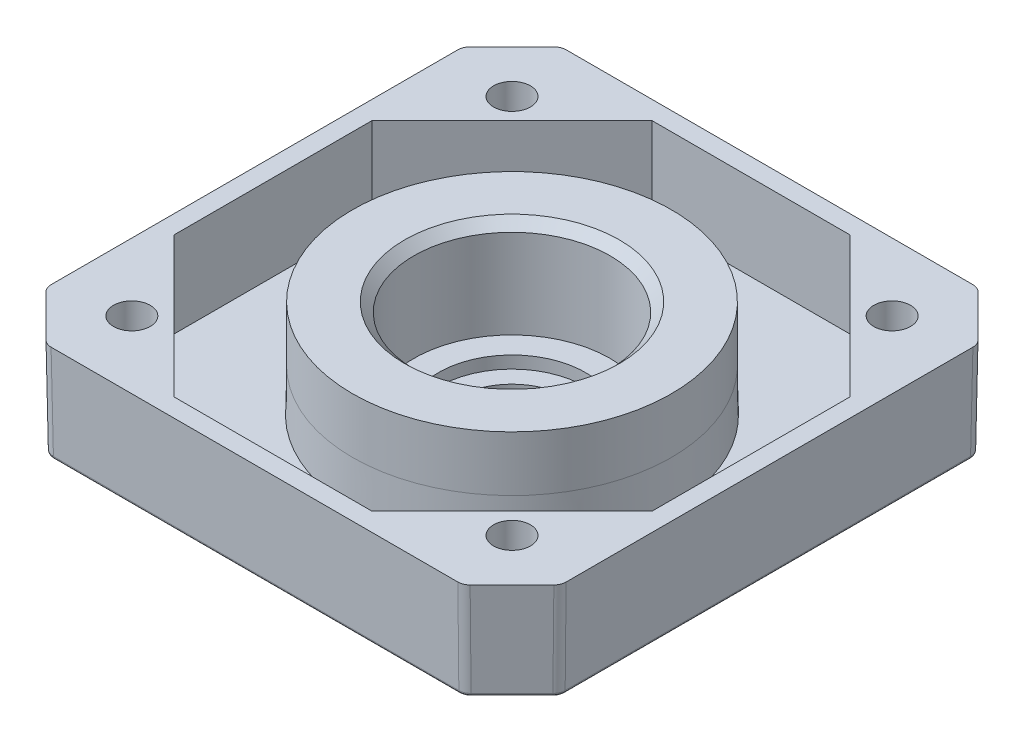
from build123d import *

# Parameters (mm, degrees)
BOSS_EXTRUDE1_DEPTH = 8
BOSS_EXTRUDE1_DRAFT = -1
SKETCH14_R          = 11
BOSS_EXTRUDE8_DEPTH = 2
FILLET2_R           = 1
CUT_EXTRUDE1_DEPTH  = 7
BOSS_EXTRUDE5_REACH = 36.012
BOSS_EXTRUDE5_START = 3.5
SKETCH6_R           = 13
BOSS_EXTRUDE5_DRAFT = 1
SKETCH7_R           = 13
BOSS_EXTRUDE6_DEPTH = 4.5
SKETCH15_R          = 1.5
CUT_EXTRUDE7_DEPTH  = 32.336879232
FILLET3_R           = 0.25
FILLET4_R           = 0.25


with BuildPart() as part:
    # Sketch1 → Boss-Extrude1 (with draft: the straight prism first)
    with BuildSketch(Plane(origin=(0, 0, 0), x_dir=(1, 0, 0), z_dir=(0, 1, 0))):
        Polygon((-17, 21), (-21, 17), (-21, -17), (-17, -21), (17, -21), (21, -17), (21, 17), (17, 21), align=None)
    extrude(amount=-BOSS_EXTRUDE1_DEPTH)
    # Boss-Extrude1: the draft: its side faces are tilted about the plane it starts from
    boss_extrude1_sides = [part.faces().sort_by_distance(p)[0] for p in [
        (-19, -4, -19),
        (-21, -4, 0),
        (-19, -4, 19),
        (0, -4, 21),
        (19, -4, 19),
        (21, -4, 0),
        (19, -4, -19),
        (0, -4, -21),
    ]]
    draft(boss_extrude1_sides, Plane(origin=(0, 0, 0), x_dir=(1, 0, 0), z_dir=(0, 1, 0)), BOSS_EXTRUDE1_DRAFT)

    # Sketch14 → Boss-Extrude8 (add)
    with BuildSketch(Plane.XZ.offset(8)):
        Circle(SKETCH14_R)
    extrude(amount=BOSS_EXTRUDE8_DEPTH)

    # Fillet2
    fillet2_edges = [part.edges().sort_by_distance(p)[0] for p in [
        (-20.93017974, -4, 16.971079501),
        (-16.971079501, -4, 20.93017974),
        (16.971079501, -4, 20.93017974),
        (20.93017974, -4, 16.971079501),
        (-20.93017974, -4, -16.971079501),
        (-16.971079501, -4, -20.93017974),
        (20.93017974, -4, -16.971079501),
        (16.971079501, -4, -20.93017974),
    ]]
    fillet(fillet2_edges, radius=FILLET2_R)

    # Sketch2 → Cut-Extrude1 (cut)
    with BuildSketch(Plane(origin=(0, 0, 0), x_dir=(1, 0, 0), z_dir=(0, 1, 0))):
        Polygon((-8.077164466, 19.5), (-19.5, 8.077164466), (-19.5, -8.077164466), (-8.077164466, -19.5), (8.077164466, -19.5), (19.5, -8.077164466), (19.5, 8.077164466), (8.077164466, 19.5), align=None)
    extrude(amount=-CUT_EXTRUDE1_DEPTH, mode=Mode.SUBTRACT)




with BuildPart() as boss_extrude5_long_prism_1:
    # Sketch6 → Boss-Extrude5 (the long prism of profile 1, to be tilted and cut off)
    with BuildSketch(Plane(origin=(0, -7, 0), x_dir=(1, 0, 0), z_dir=(0, 1, 0)).offset(BOSS_EXTRUDE5_START)):
        Circle(SKETCH6_R)
    extrude(amount=-BOSS_EXTRUDE5_REACH)
    boss_extrude5_tool1_sides = [boss_extrude5_long_prism_1.faces().sort_by_distance(p)[0] for p in [
        (-13, -21.506, 0),
    ]]
    draft(boss_extrude5_tool1_sides, Plane(origin=(0, -7, 0), x_dir=(1, 0, 0), z_dir=(0, 1, 0)).offset(BOSS_EXTRUDE5_START), BOSS_EXTRUDE5_DRAFT)  # the draft: side faces tilted about the start plane


with BuildPart() as part_1:
    add(part.part)
    boss_extrude5_tool1 = boss_extrude5_long_prism_1.part - part.part
    add(boss_extrude5_tool1.solids().sort_by_distance((0, -3.5, 0))[0])

    # Sketch7 → Boss-Extrude6 (add)
    with BuildSketch(Plane(origin=(0, -3.5, 0), x_dir=(1, 0, 0), z_dir=(0, 1, 0))):
        Circle(SKETCH7_R)
    extrude(amount=BOSS_EXTRUDE6_DEPTH)

    # Sketch9 → Cut-Revolve1 (revolve, cut)
    with BuildSketch(Plane.XY):
        with BuildLine():
            Line((6, -7), (6, -8))
            Line((6, -8), (4.5, -8))
            Line((4.5, -8), (4.5, -9.5))
            ThreePointArc((4.5, -9.5), (4.646446609, -9.853553391), (5, -10))
            Line((5, -10), (0, -10))
            Line((0, -10), (0, 1))
            Line((0, 1), (8.75, 1))
            Line((8.75, 1), (8, 0.25))
            Line((8, 0.25), (8, -7))
            Line((8, -7), (6, -7))
        make_face()
    revolve(axis=Axis((0, 1, 0), (0, -1, 0)), mode=Mode.SUBTRACT)

    # Sketch15 → Cut-Extrude7 (cut, through all)
    with BuildSketch(Plane(origin=(0, 0, 0), x_dir=(1, 0, 0), z_dir=(0, 1, 0))):
        with Locations((-15.5, 15.5)):
            Circle(SKETCH15_R)
        with Locations((-15.5, -15.5)):
            Circle(SKETCH15_R)
        with Locations((15.5, -15.5)):
            Circle(SKETCH15_R)
        with Locations((15.5, 15.5)):
            Circle(SKETCH15_R)
    extrude(amount=-CUT_EXTRUDE7_DEPTH, mode=Mode.SUBTRACT)

    # Fillet3
    fillet3_edges = [part_1.edges().sort_by_distance(p)[0] for p in [
        (-11, -8, 0),
        (-11, -10, 0),
    ]]
    fillet(fillet3_edges, radius=FILLET3_R)

    # Fillet4
    fillet4_edges = [part_1.edges().sort_by_distance(p)[0] for p in [
        (-20.784251562, -8, -16.910634071),
        (-18.901259242, -8, -18.901259242),
        (-16.910634071, -8, -20.784251562),
        (0, -8, -20.860359481),
        (16.910634071, -8, -20.784251562),
        (18.901259242, -8, -18.901259242),
        (20.784251562, -8, -16.910634071),
        (20.860359481, -8, 0),
        (20.784251562, -8, 16.910634071),
        (18.901259242, -8, 18.901259242),
        (16.910634071, -8, 20.784251562),
        (0, -8, 20.860359481),
        (-16.910634071, -8, 20.784251562),
        (-18.901259242, -8, 18.901259242),
        (-20.784251562, -8, 16.910634071),
        (-20.860359481, -8, 0),
    ]]
    fillet(fillet4_edges, radius=FILLET4_R)


solid = part_1.part
